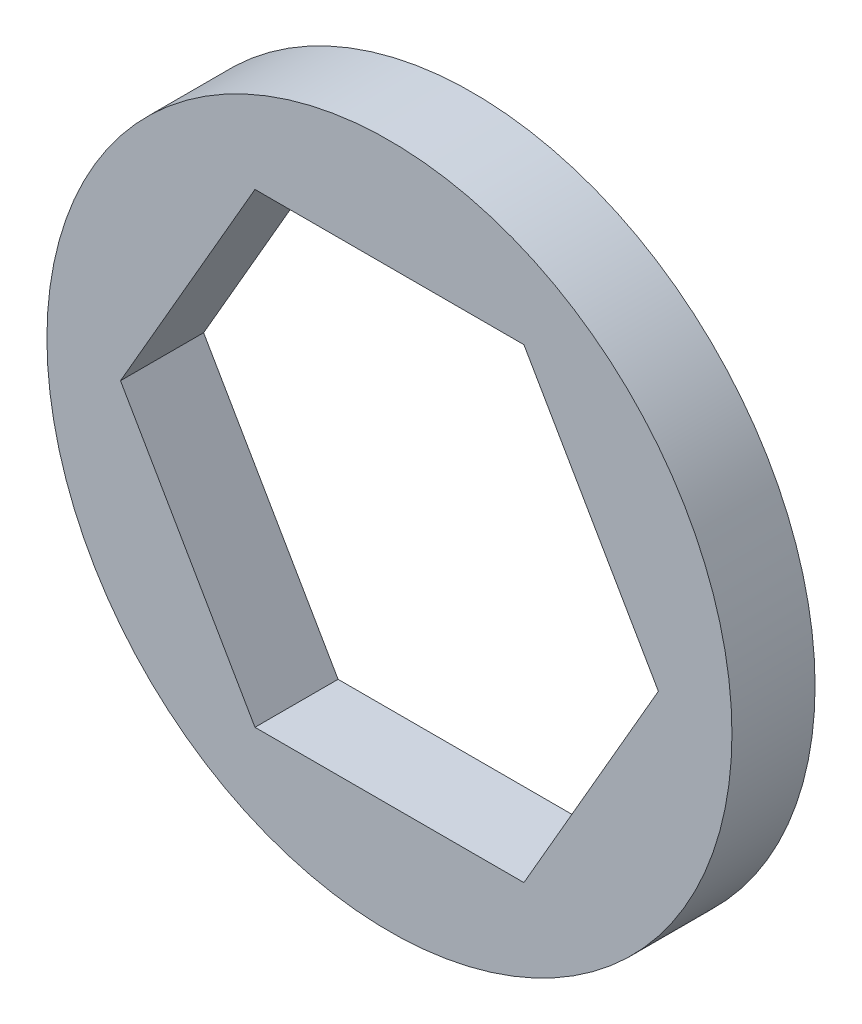
from build123d import *

# Parameters (mm, degrees)
SKETCH1_R           = 9.525
BOSS_EXTRUDE1_DEPTH = 1.1557


with BuildPart() as part:
    # Sketch1 → Boss-Extrude1 (new, symmetric)
    with BuildSketch(Plane.XY):
        Circle(SKETCH1_R)
        Polygon((7.478995387, 0), (3.739497694, 6.477), (-3.739497694, 6.477), (-7.478995387, 0), (-3.739497694, -6.477), (3.739497694, -6.477), align=None, mode=Mode.SUBTRACT)
    extrude(amount=BOSS_EXTRUDE1_DEPTH, both=True)


solid = part.part
